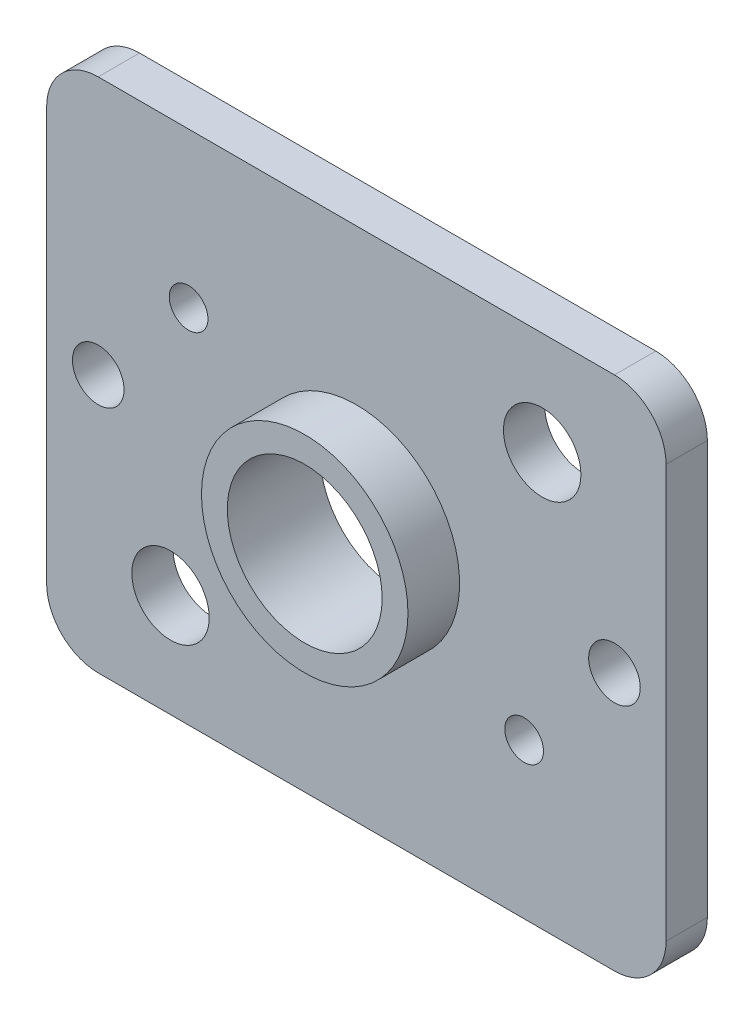
from build123d import *

# Parameters (mm, degrees)
SKETCH_1_W          = 12
SKETCH_1_H          = 10
EXTRUDE_1_DEPTH     = 0.8
CUT_EXTRUDE_1_REACH = 9.851
SKETCH_2_R          = 1.5
SKETCH_2_R_2        = 0.75
SKETCH_2_R_3        = 0.375
FILLET_1_R          = 1
SKETCH_5_R          = 0.5
CUT_EXTRUDE_2_DEPTH = 8.851114571
EXTRUDE_START       = 1
SKETCH_14_R         = 2
SKETCH_14_R_2       = 1.5
EXTRUDE_2_DEPTH     = 1


with BuildPart() as part:
    # Эскиз1 → Бобышка-Вытянуть1 (new body)
    with BuildSketch(Plane.XY):
        Rectangle(SKETCH_1_W, SKETCH_1_H)
    extrude(amount=EXTRUDE_1_DEPTH)

    # Эскиз2 → Вырез-Вытянуть1 (cut, up to next)
    with BuildSketch(Plane.XY.offset(0.8), mode=Mode.PRIVATE) as cut_extrude_1_sk1:
        Circle(SKETCH_2_R)
    cut_extrude_1_tool1 = extrude(cut_extrude_1_sk1.sketch, amount=-CUT_EXTRUDE_1_REACH, mode=Mode.PRIVATE) & part.part
    # Эскиз2 → Вырез-Вытянуть1 (cut, up to next)
    with BuildSketch(Plane.XY.offset(0.8), mode=Mode.PRIVATE) as cut_extrude_1_sk2:
        with Locations((-3.6, -3)):
            Circle(SKETCH_2_R_2)
    cut_extrude_1_tool2 = extrude(cut_extrude_1_sk2.sketch, amount=-CUT_EXTRUDE_1_REACH, mode=Mode.PRIVATE) & part.part
    # Эскиз2 → Вырез-Вытянуть1 (cut, up to next)
    with BuildSketch(Plane.XY.offset(0.8), mode=Mode.PRIVATE) as cut_extrude_1_sk3:
        with Locations((3.6, 3)):
            Circle(SKETCH_2_R_2)
    cut_extrude_1_tool3 = extrude(cut_extrude_1_sk3.sketch, amount=-CUT_EXTRUDE_1_REACH, mode=Mode.PRIVATE) & part.part
    # Эскиз2 → Вырез-Вытянуть1 (cut, up to next)
    with BuildSketch(Plane.XY.offset(0.8), mode=Mode.PRIVATE) as cut_extrude_1_sk4:
        with Locations((3.25, -2)):
            Circle(SKETCH_2_R_3)
    cut_extrude_1_tool4 = extrude(cut_extrude_1_sk4.sketch, amount=-CUT_EXTRUDE_1_REACH, mode=Mode.PRIVATE) & part.part
    # Эскиз2 → Вырез-Вытянуть1 (cut, up to next)
    with BuildSketch(Plane.XY.offset(0.8), mode=Mode.PRIVATE) as cut_extrude_1_sk5:
        with Locations((-3.25, 2)):
            Circle(SKETCH_2_R_3)
    cut_extrude_1_tool5 = extrude(cut_extrude_1_sk5.sketch, amount=-CUT_EXTRUDE_1_REACH, mode=Mode.PRIVATE) & part.part
    add(cut_extrude_1_tool1.solids().sort_by_distance((0, 0, 0.8))[0], mode=Mode.SUBTRACT)
    add(cut_extrude_1_tool2.solids().sort_by_distance((-3.6, -3, 0.8))[0], mode=Mode.SUBTRACT)
    add(cut_extrude_1_tool3.solids().sort_by_distance((3.6, 3, 0.8))[0], mode=Mode.SUBTRACT)
    add(cut_extrude_1_tool4.solids().sort_by_distance((3.25, -2, 0.8))[0], mode=Mode.SUBTRACT)
    add(cut_extrude_1_tool5.solids().sort_by_distance((-3.25, 2, 0.8))[0], mode=Mode.SUBTRACT)

    # Скругление1
    fillet_1_edges = [part.edges().sort_by_distance(p)[0] for p in [
        (6, -5, 0.4),
        (-6, -5, 0.4),
        (-6, 5, 0.4),
        (6, 5, 0.4),
    ]]
    fillet(fillet_1_edges, radius=FILLET_1_R)

    # Эскиз5 → Вырез-Вытянуть2 (cut, through all)
    with BuildSketch(Plane.XY.offset(0.8)):
        with Locations((5, 0)):
            Circle(SKETCH_5_R)
        with Locations((-5, 0)):
            Circle(SKETCH_5_R)
    extrude(amount=-CUT_EXTRUDE_2_DEPTH, mode=Mode.SUBTRACT)

    # Эскиз14 → Бобышка-Вытянуть2 (add)
    with BuildSketch(Plane.XY.offset(0.8).offset(EXTRUDE_START)):
        Circle(SKETCH_14_R)
        Circle(SKETCH_14_R_2, mode=Mode.SUBTRACT)
    extrude(amount=-EXTRUDE_2_DEPTH)


solid = part.part
